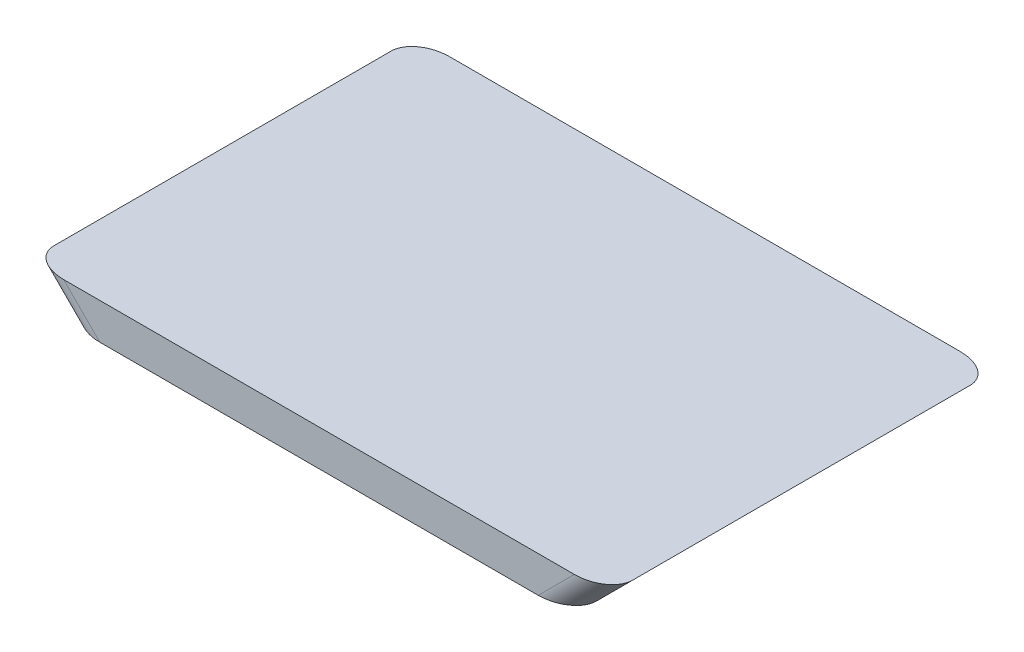
from build123d import *

# Parameters (mm, degrees)
BOSS_EXTRUDE1_DEPTH = 50.8
FILLET1_R           = 3.175


with BuildPart() as part:
    # Sketch1 → Boss-Extrude1 (new body)
    with BuildSketch(Plane.XY):
        Polygon((-38.1, 2.38125), (38.1, 2.38125), (33.3375, -2.38125), (-33.3375, -2.38125), align=None)
    extrude(amount=BOSS_EXTRUDE1_DEPTH)

    # Fillet1
    fillet1_edges = [part.edges().sort_by_distance(p)[0] for p in [
        (35.71875, 0, 50.8),
        (-35.71875, 0, 50.8),
        (-35.71875, 0, 0),
        (35.71875, 0, 0),
    ]]
    fillet(fillet1_edges, radius=FILLET1_R)


solid = part.part
